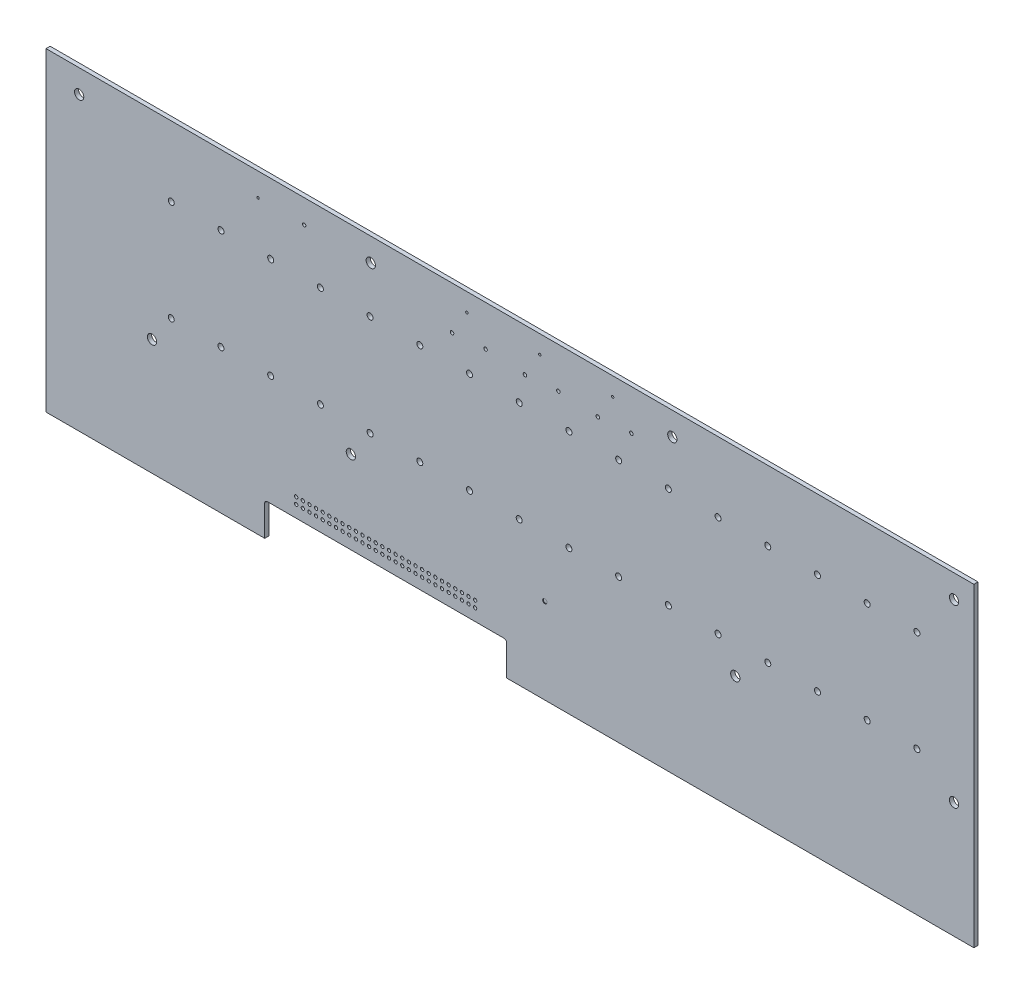
from build123d import *

# Parameters (mm, degrees)
SKETCH1_W                    = 355.6
SKETCH1_H                    = 120.65
EXTRUDE1_DEPTH               = 1.5748
DSPBOARD_CONNECTOR_HOLES_R   = 1.15
CUT_EXTRUDE1_DEPTH           = 2.54
LPATTERN1_COUNT              = 16
LPATTERN1_PITCH              = 19.05
SKETCH2_R                    = 1.778
PCB_MOUNT_HOLES_DEPTH        = 2.54
SKETCH6_R                    = 0.675005
PERIPHERAL_SATA_DEPTH        = 2.54
SKETCH7_R                    = 0.4499991
SKETCH7_R_2                  = 0.449961
OFF_BOARD_HEADER_HOLES_DEPTH = 2.54
NIC_CUTOUT_DEPTH             = 2.54
SKETCH10_R                   = 0.635
HEADER_HOLES_DEPTH           = 2.54
BGA_MOUNT_POS_R              = 0.838088067
CUT_EXTRUDE11_DEPTH          = 0.254
LPATTERN3_COUNT              = 28
LPATTERN3_PITCH              = 2.54
LPATTERN3_COUNT_DIR2         = 2
LPATTERN3_PITCH_DIR2         = 2.54
LPATTERN4_COUNT              = 3
LPATTERN4_PITCH              = 27.94
SKETCH11_R                   = 0.635
JTAG_HOLE_DEPTH              = 2.54


with BuildPart() as part:
    # Sketch1 → Extrude1 (new body)
    with BuildSketch(Plane.XY):
        with Locations((177.8, -60.325)):
            Rectangle(SKETCH1_W, SKETCH1_H)
    extrude(amount=EXTRUDE1_DEPTH)

    # DSPboard connector holes → Cut-Extrude1 (cut)
    with BuildSketch(Plane.XY.offset(1.5748)):
        with Locations((48.006, -65.532)):
            Circle(DSPBOARD_CONNECTOR_HOLES_R)
        with Locations((48.006, -26.802)):
            Circle(DSPBOARD_CONNECTOR_HOLES_R)
    cut_extrude1 = extrude(amount=-CUT_EXTRUDE1_DEPTH, mode=Mode.SUBTRACT)

    # LPattern1: Cut-Extrude1 ×16
    with Locations(*[(i * LPATTERN1_PITCH, 0, 0) for i in range(1, LPATTERN1_COUNT)]):
        add(cut_extrude1, mode=Mode.SUBTRACT)

    # Sketch2 → PCB Mount holes (cut)
    with BuildSketch(Plane.XY.offset(1.5748)):
        with Locations((12.7, -8.89)):
            Circle(SKETCH2_R)
        with Locations((124.46, -8.89)):
            Circle(SKETCH2_R)
        with Locations((240.03, -8.89)):
            Circle(SKETCH2_R)
        with Locations((347.98, -8.89)):
            Circle(SKETCH2_R)
        with Locations((40.64, -76.2)):
            Circle(SKETCH2_R)
        with Locations((116.84, -76.2)):
            Circle(SKETCH2_R)
        with Locations((264.16, -76.2)):
            Circle(SKETCH2_R)
        with Locations((347.98, -76.2)):
            Circle(SKETCH2_R)
    extrude(amount=-PCB_MOUNT_HOLES_DEPTH, mode=Mode.SUBTRACT)

    # Sketch6 → Peripheral-SATA (cut)
    with BuildSketch(Plane.XY.offset(1.5748)):
        with Locations((168.4383248, -15.51)):
            Circle(SKETCH6_R)
        with Locations((155.6083248, -16.51)):
            Circle(SKETCH6_R)
    peripheral_sata = extrude(amount=-PERIPHERAL_SATA_DEPTH, mode=Mode.SUBTRACT)

    # Sketch7 → Off-board header holes (cut)
    with BuildSketch(Plane.XY.offset(1.5748)):
        with Locations((217.17, -6.985)):
            Circle(SKETCH7_R)
        with Locations((189.23, -6.985)):
            Circle(SKETCH7_R_2)
        with Locations((161.29, -6.985)):
            Circle(SKETCH7_R_2)
        with Locations((81.28, -8.89)):
            Circle(SKETCH7_R_2)
    extrude(amount=-OFF_BOARD_HEADER_HOLES_DEPTH, mode=Mode.SUBTRACT)

    # Sketch9 → NIC cutout (cut)
    with BuildSketch(Plane.XY.offset(1.5748)):
        with BuildLine():
            Line((84.836, -107.95), (175.514, -107.95))
            ThreePointArc((175.514, -107.95), (176.23242049, -108.24757951), (176.53, -108.966))
            Line((176.53, -108.966), (176.53, -120.65))
            Line((176.53, -120.65), (83.82, -120.65))
            Line((83.82, -120.65), (83.82, -108.966))
            ThreePointArc((83.82, -108.966), (84.11757951, -108.24757951), (84.836, -107.95))
        make_face()
    extrude(amount=-NIC_CUTOUT_DEPTH, mode=Mode.SUBTRACT)

    # Sketch10 → Header Holes (cut)
    with BuildSketch(Plane.XY.offset(1.5748)):
        with Locations((164.465, -100.838)):
            Circle(SKETCH10_R)
    header_holes = extrude(amount=-HEADER_HOLES_DEPTH, mode=Mode.SUBTRACT)

    # BGA mount pos → Cut-Extrude11 (cut)
    with BuildSketch(Plane.XY.offset(1.5748)):
        with Locations((191.2, -87.85)):
            Circle(BGA_MOUNT_POS_R)
    extrude(amount=-CUT_EXTRUDE11_DEPTH, mode=Mode.SUBTRACT)

    # LPattern3: Header Holes 28 × 2
    with Locations(*[(-i * LPATTERN3_PITCH, -j * LPATTERN3_PITCH_DIR2, 0) for i in range(LPATTERN3_COUNT) for j in range(LPATTERN3_COUNT_DIR2) if (i, j) != (0, 0)]):
        add(header_holes, mode=Mode.SUBTRACT)

    # LPattern4: Peripheral-SATA ×3
    with Locations(*[(i * LPATTERN4_PITCH, 0, 0) for i in range(1, LPATTERN4_COUNT)]):
        add(peripheral_sata, mode=Mode.SUBTRACT)

    # Sketch11 → JTAG hole (cut)
    with BuildSketch(Plane(origin=(0, 0, 0), x_dir=(-1, 0, 0), z_dir=(0, 0, -1))):
        with Locations((-98.94, -9.044)):
            Circle(SKETCH11_R)
    extrude(amount=-JTAG_HOLE_DEPTH, mode=Mode.SUBTRACT)


solid = part.part
